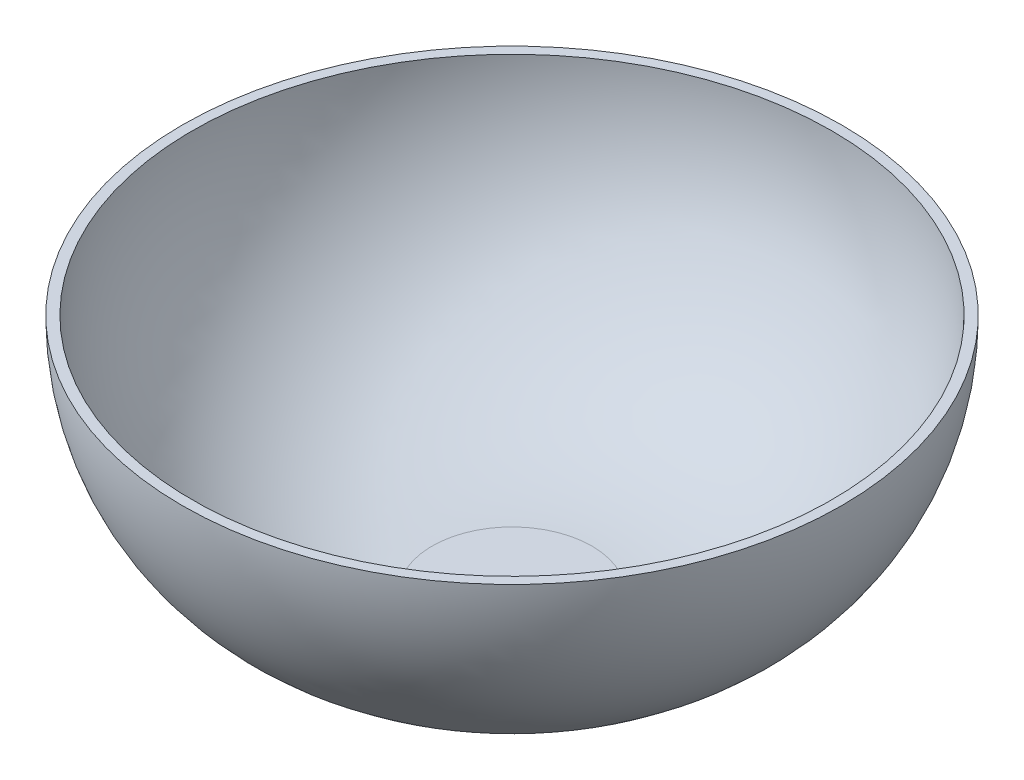
from build123d import *

# Parameters (mm, degrees)
SKETCH2_R          = 6.35
CUT_EXTRUDE1_DEPTH = 4.826


with BuildPart() as part:
    # Sketch1 → Revolve1 (revolve)
    with BuildSketch(Plane.XY):
        with BuildLine():
            Line((209.55, 158.75), (203.2, 158.75))
            ThreePointArc((203.2, 158.75), (158.563073453, 50.986926547), (50.8, 6.35))
            Line((50.8, 6.35), (0, 6.35))
            Line((0, 6.35), (0, 0))
            Line((0, 0), (50.8, 0))
            ThreePointArc((50.8, 0), (163.053201513, 46.496798487), (209.55, 158.75))
        make_face()
    revolve(axis=Axis((0, 0, 0), (0, 1, 0)))

    # Sketch2 → Cut-Extrude1 (cut)
    with BuildSketch(Plane.XZ):
        Circle(SKETCH2_R)
    extrude(amount=-CUT_EXTRUDE1_DEPTH, mode=Mode.SUBTRACT)


solid = part.part
